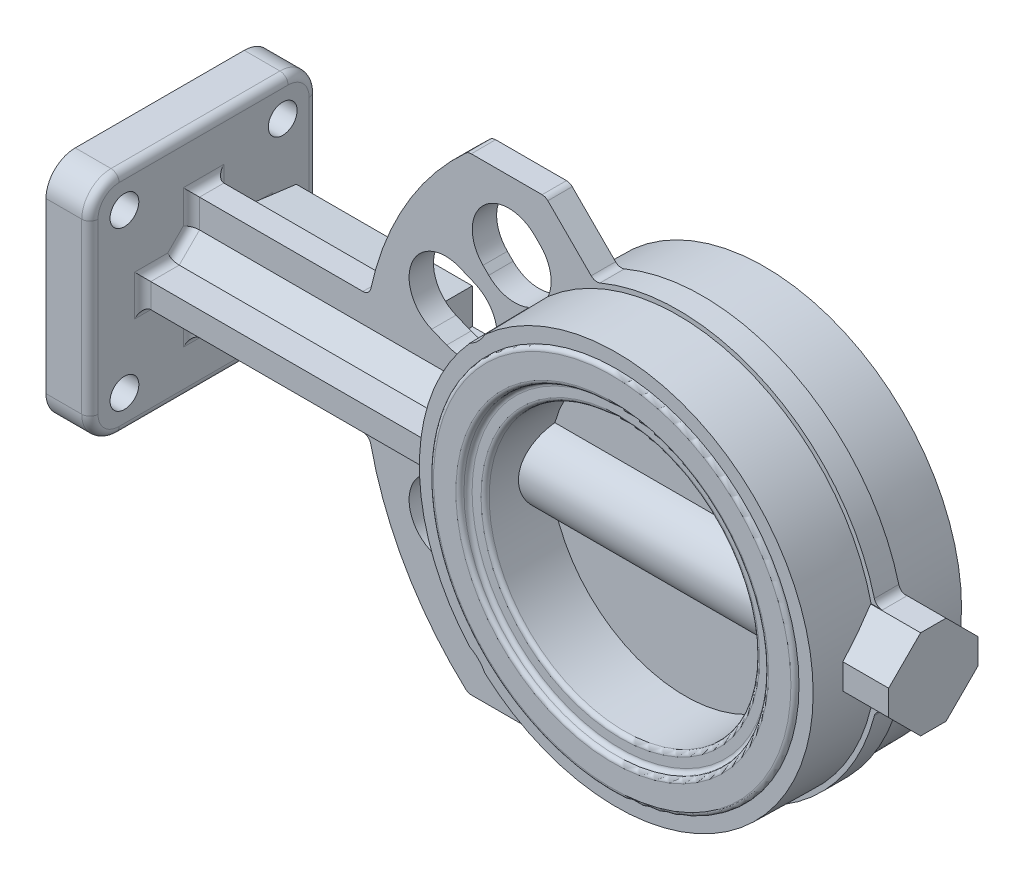
from build123d import *

# Parameters (mm, degrees)
SKETCH1_R                     = 61.976
BOSS_EXTRUDE1_DEPTH           = 23.19655
BOSS_EXTRUDE1_TAPER           = 1
BOSS_EXTRUDE1_OTHER_WAY_DEPTH = 23.19655
BOSS_EXTRUDE1_OTHER_WAY_TAPER = 1
SKETCH2_R                     = 57.15
BOSS_EXTRUDE2_DEPTH           = 1.27
BOSS_EXTRUDE3_START           = 1.27
SKETCH3_R                     = 57.15
BOSS_EXTRUDE3_DEPTH           = 1.27
SKETCH4_R                     = 47.625
CUT_EXTRUDE1_DEPTH            = 2.54
CUT_EXTRUDE2_START            = -2.54
SKETCH5_R                     = 47.625
CUT_EXTRUDE2_DEPTH            = 2.54
SKETCH6_R                     = 42.291
CUT_EXTRUDE3_DEPTH            = 100.168386618
SKETCH7_W                     = 6.35
SKETCH7_H                     = 7.62
SKETCH8_W                     = 27.94
SKETCH8_H                     = 27.94
BOSS_EXTRUDE4_DEPTH           = 18.796
CHAMFER1_SIZE                 = 10
BOSS_EXTRUDE5_DEPTH           = 88.9
BOSS_EXTRUDE5_DEPTH_BACK      = 12.7
BOSS_EXTRUDE6_DEPTH           = 7.62
SKETCH11_W                    = 71.12
SKETCH11_H                    = 71.12
BOSS_EXTRUDE7_DEPTH           = 13.716
CHAMFER2_SIZE                 = 6.35
FILLET1_R                     = 9.144
SKETCH12_W                    = 57.15
SKETCH12_H                    = 31.75
BOSS_EXTRUDE8_DEPTH           = 15.24
BOSS_EXTRUDE8_TAPER           = 4
CUT_EXTRUDE4_DEPTH            = 186.645307933
CUT_EXTRUDE4_DEPTH_BACK       = 186.645307933
FILLET2_R                     = 1.27
FILLET3_R                     = 2.54
SKETCH14_R                    = 9.525
CUT_EXTRUDE5_DEPTH            = 7.62
M8_CLEARANCE_HOLE1_D          = 9
M8_CLEARANCE_HOLE1_DEPTH      = 13.716
SKETCH18_R                    = 11.5
BOSS_EXTRUDE9_DEPTH           = 127
SKETCH19_R                    = 7
BOSS_EXTRUDE10_DEPTH          = 6.62
BOSS_EXTRUDE11_DEPTH          = 19
CHAMFER3_SIZE                 = 1.5
SKETCH21_R                    = 42.291
BOSS_EXTRUDE12_DEPTH          = 1.665


# Some blends are built 0.0001 mm under size
with BuildPart() as part:
    # Sketch1 → Boss-Extrude1 (new body)
    with BuildSketch(Plane.XY):
        Circle(SKETCH1_R)
    extrude(amount=BOSS_EXTRUDE1_DEPTH, taper=BOSS_EXTRUDE1_TAPER)

    # Sketch1 → Boss-Extrude1 other way (add)
    with BuildSketch(Plane.XY):
        Circle(SKETCH1_R)
    extrude(amount=-BOSS_EXTRUDE1_OTHER_WAY_DEPTH, taper=BOSS_EXTRUDE1_OTHER_WAY_TAPER)

    # Sketch2 → Boss-Extrude2 (add)
    with BuildSketch(Plane.XY.offset(23.19655)):
        Circle(SKETCH2_R)
    extrude(amount=BOSS_EXTRUDE2_DEPTH)

    # Sketch3 → Boss-Extrude3 (add)
    with BuildSketch(Plane(origin=(0, 0, -23.19655), x_dir=(-1, 0, 0), z_dir=(0, 0, -1)).offset(BOSS_EXTRUDE3_START)):
        with Locations(Location((0, 0, 0), (0, 0, 180))):
            Circle(SKETCH3_R)
    extrude(amount=-BOSS_EXTRUDE3_DEPTH)

    # Sketch4 → Cut-Extrude1 (cut)
    with BuildSketch(Plane(origin=(0, 0, -24.46655), x_dir=(-1, 0, 0), z_dir=(0, 0, -1))):
        Circle(SKETCH4_R)
    extrude(amount=-CUT_EXTRUDE1_DEPTH, mode=Mode.SUBTRACT)

    # Sketch5 → Cut-Extrude2 (cut)
    with BuildSketch(Plane.XY.offset(24.46655).offset(CUT_EXTRUDE2_START)):
        with Locations(Location((0, 0, 0), (0, 0, 180))):
            Circle(SKETCH5_R)
    extrude(amount=CUT_EXTRUDE2_DEPTH, mode=Mode.SUBTRACT)

    # Sketch6 → Cut-Extrude3 (cut, through all)
    with BuildSketch(Plane.XY.offset(21.92655)):
        Circle(SKETCH6_R)
    extrude(amount=-CUT_EXTRUDE3_DEPTH, mode=Mode.SUBTRACT)

    # Sketch7 → Revolve1 (revolve)
    with BuildSketch(Plane(origin=(0, 0, 0), x_dir=(1, 0, 0), z_dir=(0, 1, 0)), mode=Mode.PRIVATE) as revolve1_sk:
        with Locations((-60.174102714, 0)):
            Rectangle(SKETCH7_W, SKETCH7_H)
    revolve(revolve1_sk.sketch.rotate(Axis((0, 0, 0), (0, 0, -1)), 180), axis=Axis((0, 0, 0), (0, 0, -1)))

    # Sketch8 → Boss-Extrude4 (add)
    with BuildSketch(Plane(origin=(57.15, 0, 0), x_dir=(0, 0, -1), z_dir=(1, 0, 0))):
        Rectangle(SKETCH8_W, SKETCH8_H)
    extrude(amount=BOSS_EXTRUDE4_DEPTH)

    # Chamfer1
    chamfer1_edges = [part.edges().sort_by_distance(p)[0] for p in [
        (68.038336279, 13.97, -13.97),
        (68.038336279, -13.97, -13.97),
        (68.038336279, -13.97, 13.97),
        (68.038336279, 13.97, 13.97),
    ]]
    chamfer(chamfer1_edges, length=CHAMFER1_SIZE)

    # Sketch9 → Boss-Extrude5 (add, two sides: drawn at the far end of the back side and taken through both)
    with BuildSketch(Plane.ZY.offset(63.349102714).offset(-BOSS_EXTRUDE5_DEPTH_BACK)):
        Polygon((-19.05, 3.81), (-3.81, 3.81), (-3.81, 19.05), (3.81, 19.05), (3.81, 3.81), (19.05, 3.81), (19.05, -3.81), (3.81, -3.81), (3.81, -19.05), (-3.81, -19.05), (-3.81, -3.81), (-19.05, -3.81), align=None)
    extrude(amount=BOSS_EXTRUDE5_DEPTH + BOSS_EXTRUDE5_DEPTH_BACK)

    # Sketch10 → Boss-Extrude6 (add)
    with BuildSketch(Plane(origin=(0, 0, -3.81), x_dir=(-1, 0, 0), z_dir=(0, 0, -1))):
        with BuildLine():
            Line((26.012215022, 57.762215022), (41.528701809, 73.278701809))
            Line((41.528701809, 73.278701809), (65.709302889, 73.278701809))
            ThreePointArc((65.709302889, 73.278701809), (85.547252916, 48.673895915), (96.563855168, 19.05))
            Line((96.563855168, 19.05), (60.416937316, 19.05))
            ThreePointArc((60.416937316, 19.05), (47.351436002, 42.0826606), (26.012215022, 57.762215022))
        make_face()
        with BuildLine():
            Line((26.012215022, -57.762215022), (41.528701809, -73.278701809))
            Line((41.528701809, -73.278701809), (65.709302889, -73.278701809))
            ThreePointArc((65.709302889, -73.278701809), (85.547252916, -48.673895915), (96.563855168, -19.05))
            Line((96.563855168, -19.05), (60.416937316, -19.05))
            ThreePointArc((60.416937316, -19.05), (47.351436002, -42.0826606), (26.012215022, -57.762215022))
        make_face()
    extrude(amount=-BOSS_EXTRUDE6_DEPTH)

    # Sketch11 → Boss-Extrude7 (add)
    with BuildSketch(Plane.ZY.offset(152.249102714)):
        Rectangle(SKETCH11_W, SKETCH11_H)
    extrude(amount=BOSS_EXTRUDE7_DEPTH)

    # Chamfer2
    chamfer2_edges = [part.edges().sort_by_distance(p)[0] for p in [
        (-107.020625622, 3.81, 3.81),
        (-107.020625622, -3.81, 3.81),
        (-107.020625622, 3.81, -3.81),
        (-107.020625622, -3.81, -3.81),
    ]]
    chamfer(chamfer2_edges, length=CHAMFER2_SIZE)

    # Fillet1
    fillet1_edges = [part.edges().sort_by_distance(p)[0] for p in [
        (-159.107102714, 35.56, -35.56),
        (-159.107102714, -35.56, -35.56),
        (-159.107102714, -35.56, 35.56),
        (-159.107102714, 35.56, 35.56),
    ]]
    fillet(fillet1_edges, radius=FILLET1_R)

    # Sketch12 → Boss-Extrude8 (add)
    with BuildSketch(Plane(origin=(0, 0, -3.81), x_dir=(-1, 0, 0), z_dir=(0, 0, -1))):
        with Locations((114.784102714, 0)):
            Rectangle(SKETCH12_W, SKETCH12_H)
    extrude(amount=BOSS_EXTRUDE8_DEPTH, taper=BOSS_EXTRUDE8_TAPER)

    # Sketch13 → Cut-Extrude4 (cut, two sides: drawn at the far end of the back side and taken through both)
    with BuildSketch(Plane(origin=(0, 0, -3.81), x_dir=(-1, 0, 0), z_dir=(0, 0, -1)).offset(-CUT_EXTRUDE4_DEPTH_BACK)):
        with BuildLine():
            Line((77.120346022, 19.572550408), (72.427037997, 17.628518571))
            ThreePointArc((72.427037997, 17.628518571), (57.493023308, 23.814389996), (63.678894733, 38.748404685))
            Line((63.678894733, 38.748404685), (68.372202758, 40.692436521))
            ThreePointArc((68.372202758, 40.692436521), (83.306217447, 34.506565096), (77.120346022, 19.572550408))
        make_face()
        with BuildLine():
            Line((61.065741623, 44.901280605), (59.269690399, 43.105229381))
            ThreePointArc((59.269690399, 43.105229381), (43.105229381, 43.105229381), (43.105229381, 59.269690399))
            Line((43.105229381, 59.269690399), (44.901280605, 61.065741623))
            ThreePointArc((44.901280605, 61.065741623), (61.065741623, 61.065741623), (61.065741623, 44.901280605))
        make_face()
        with BuildLine():
            Line((68.372202758, -40.692436521), (63.678894733, -38.748404685))
            ThreePointArc((63.678894733, -38.748404685), (57.493023308, -23.814389996), (72.427037997, -17.628518571))
            Line((72.427037997, -17.628518571), (77.120346022, -19.572550408))
            ThreePointArc((77.120346022, -19.572550408), (83.306217447, -34.506565096), (68.372202758, -40.692436521))
        make_face()
        with BuildLine():
            Line((44.901280605, -61.065741623), (43.105229381, -59.269690399))
            ThreePointArc((43.105229381, -59.269690399), (43.105229381, -43.105229381), (59.269690399, -43.105229381))
            Line((59.269690399, -43.105229381), (61.065741623, -44.901280605))
            ThreePointArc((61.065741623, -44.901280605), (61.065741623, -61.065741623), (44.901280605, -61.065741623))
        make_face()
    extrude(amount=CUT_EXTRUDE4_DEPTH + CUT_EXTRUDE4_DEPTH_BACK, mode=Mode.SUBTRACT)

    # Fillet2
    fillet2_edges = [part.edges().sort_by_distance(p)[0] for p in [
        (-57.15, 0, 24.46655),
        (-57.15, 0, -24.46655),
        (47.625, 0, -24.46655),
        (47.625, 0, 21.92655),
        (47.625, 0, 24.46655),
        (-42.291, 0, -21.92655),
        (-42.291, 0, 21.92655),
    ]]
    fillet(fillet2_edges, radius=FILLET2_R - 0.0001)  # a hair under: the kernel refuses the full size

    # Fillet3
    fillet3_edges = [part.edges().sort_by_distance(p)[0] for p in [
        (-152.249102714, 0, 19.05),
        (-152.249102714, 3.81, 14.605),
        (-152.249102714, 19.05, 0),
        (-152.249102714, 14.605, -3.81),
        (-152.249102714, 0, -19.05),
        (-152.249102714, -3.81, -14.605),
        (-152.249102714, -19.05, 0),
        (-152.249102714, -14.605, 3.81),
        (-41.528701809, 73.278701809, 0),
        (-65.709302889, 73.278701809, 0),
        (-96.563855168, 19.05, 0),
        (-26.012215022, 57.762215022, 0),
        (-65.709302889, -73.278701809, 0),
        (-41.528701809, -73.278701809, 0),
        (-26.012215022, -57.762215022, 0),
        (-96.563855168, -19.05, 0),
        (-152.249102714, 14.605, 3.81),
        (-152.249102714, -3.81, 14.605),
        (-152.249102714, 3.81, -14.605),
        (-152.249102714, -14.605, -3.81),
        (-152.249102714, 6.985, -6.985),
        (-152.249102714, -6.985, -6.985),
        (-152.249102714, -6.985, 6.985),
        (-152.249102714, 6.985, 6.985),
        (-152.249102714, 0, -35.56),
        (-152.249102714, 35.56, 0),
        (-152.249102714, 0, 35.56),
        (-152.249102714, -35.56, 0),
        (-152.249102714, -32.881784407, 32.881784407),
        (-152.249102714, -32.881784407, -32.881784407),
        (-152.249102714, 32.881784407, 32.881784407),
        (-152.249102714, 32.881784407, -32.881784407),
        (61.789545351, 13.97, 0),
        (61.789545351, -13.97, 0),
    ]]
    fillet(fillet3_edges, radius=FILLET3_R)

    # Sketch14 → Cut-Extrude5 (cut)
    with BuildSketch(Plane.ZY.offset(165.965102714)):
        Circle(SKETCH14_R)
    extrude(amount=-CUT_EXTRUDE5_DEPTH, mode=Mode.SUBTRACT)

    # M8 Clearance Hole1
    with Locations(Plane.ZY.offset(165.965102714)):
        with Locations((-24.748737342, 24.748737342), (24.748737342, 24.748737342), (24.748737342, -24.748737342), (-24.748737342, -24.748737342)):
            Hole(M8_CLEARANCE_HOLE1_D / 2, depth=M8_CLEARANCE_HOLE1_DEPTH)

    # Sketch18 → Boss-Extrude9 (add)
    with BuildSketch(Plane(origin=(75.946, 0, 0), x_dir=(0, 0, -1), z_dir=(1, 0, 0))):
        Circle(SKETCH18_R)
    extrude(amount=-BOSS_EXTRUDE9_DEPTH)

    # Sketch19 → Boss-Extrude10 (add)
    with BuildSketch(Plane.ZY.offset(158.345102714)):
        with Locations(Location((0, 0, 0), (0, 0, 180))):
            Circle(SKETCH19_R)
    extrude(amount=BOSS_EXTRUDE10_DEPTH)

    # Sketch20 → Boss-Extrude11 (add)
    with BuildSketch(Plane.ZY.offset(164.965102714)):
        Polygon((0, 7.778174593), (-7.778174593, 0), (0, -7.778174593), (7.778174593, 0), align=None)
    extrude(amount=BOSS_EXTRUDE11_DEPTH)

    # Chamfer3
    # the kernel refuses this chamfer: 1.5 mm, written as the material it takes off along each edge
    with BuildSketch(Plane(origin=(-164.965102714, 0, 7.778174593), x_dir=(0, 0.7262819568766865, -0.6873969152646604), z_dir=(-1, 0, 0)), Plane(origin=(-164.965102714, 7.778174593, 0), x_dir=(0, -0.6873969152646582, -0.7262819568766886), z_dir=(-1, 0, 0)), Plane(origin=(-164.965102714, 0, -7.778174593), x_dir=(0, -0.7262819568766865, 0.6873969152646606), z_dir=(-1, 0, 0))) as chamfer3_piece_1:
        Polygon((CHAMFER3_SIZE * 0.999621916911, CHAMFER3_SIZE * 0.0274958766106), (-CHAMFER3_SIZE * 0.0274958766106, CHAMFER3_SIZE * 0.999621916911), (0, 0), align=None)
    extrude(amount=22.857524482, mode=Mode.SUBTRACT)
    with BuildSketch(Plane(origin=(-164.965102714, -7.778174593, 0), x_dir=(0, 0.6873969152646581, -0.7262819568766888), z_dir=(-1, 0, 0))) as chamfer3_piece_2:
        Polygon((CHAMFER3_SIZE * 0.999621916911, -CHAMFER3_SIZE * 0.0274958766106), (-CHAMFER3_SIZE * 0.0274958766106, -CHAMFER3_SIZE * 0.999621916911), (0, 0), align=None)
    extrude(amount=22.857524482, mode=Mode.SUBTRACT)

    # Sketch21 → Boss-Extrude12 (add, symmetric)
    with BuildSketch(Plane.XY):
        with Locations(Location((0, 0, 0), (0, 0, 344.391643827))):
            Circle(SKETCH21_R)
    extrude(amount=BOSS_EXTRUDE12_DEPTH, both=True)


solid = part.part
